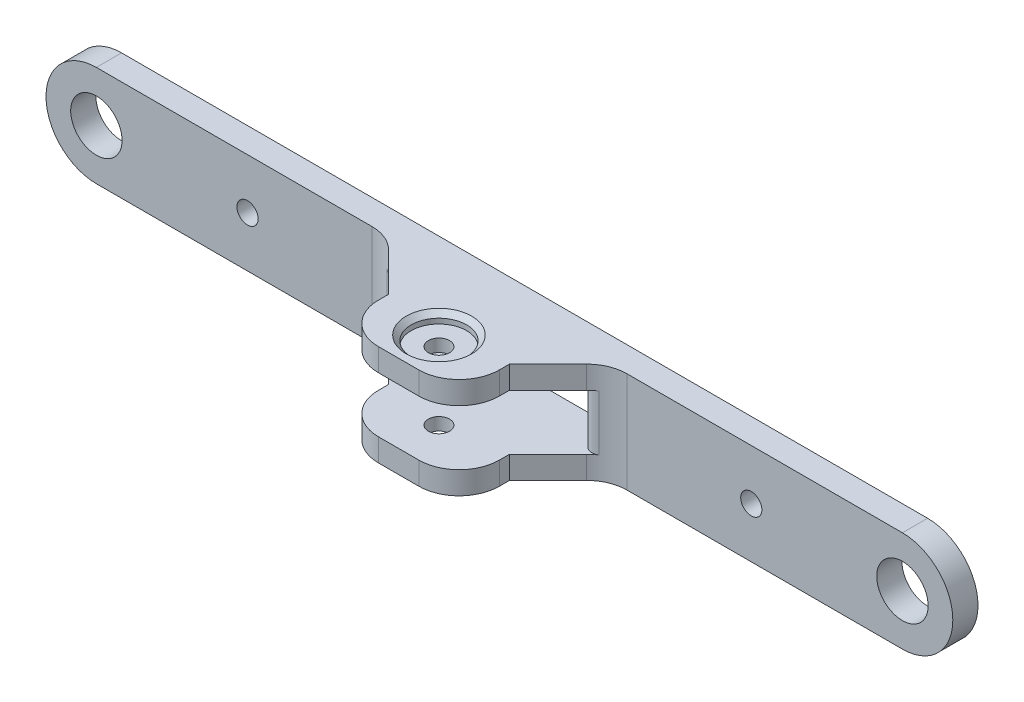
from build123d import *

# Parameters (mm, degrees)
BOSS_EXTRU_1_DEPTH      = 5
ESQUISSE2_R             = 5.1
ESQUISSE2_R_2           = 2.1
ENL_V_MAT_EXTRU_1_DEPTH = 91.691785736
ESQUISSE3_W             = 24
ESQUISSE3_H             = 20
BOSS_EXTRU_2_DEPTH      = 20
CHANFREIN1_SIZE         = 10
ESQUISSE4_W             = 36
ESQUISSE4_H             = 11
ENL_V_MAT_EXTRU_2_DEPTH = 20
ESQUISSE5_R             = 2.1
ENL_V_MAT_EXTRU_3_DEPTH = 96.524865873
CONG_1_R                = 8
ESQUISSE6_R             = 5.5
ENL_V_MAT_EXTRU_4_DEPTH = 2
CHANFREIN2_SIZE         = 1
CONG_4_R                = 2
ENL_V_START             = -2
ESQUISSE7_R             = 5.5
ENL_V_MAT_EXTRU_5_DEPTH = 2
CHANFREIN3_SIZE         = 1
ESQUISSE8_W             = 36
ESQUISSE8_H             = 11
ENL_V_MAT_EXTRU_6_DEPTH = 93.736184955
ESQUISSE9_W             = 2
ESQUISSE9_H             = 5
ENL_V_MAT_EXTRU_7_DEPTH = 2


with BuildPart() as part:
    # Esquisse1 → Boss.-Extru.1 (new body)
    with BuildSketch(Plane.XY):
        with BuildLine():
            Line((-80, 10), (80, 10))
            ThreePointArc((80, 10), (90, 0), (80, -10))
            Line((80, -10), (-80, -10))
            ThreePointArc((-80, -10), (-90, 0), (-80, 10))
        make_face()
    extrude(amount=BOSS_EXTRU_1_DEPTH)

    # Esquisse2 → Enlèv. mat.-Extru.1 (cut, through all)
    with BuildSketch(Plane.XY.offset(5)):
        with Locations((-80, 0)):
            Circle(ESQUISSE2_R)
        with Locations((80, 0)):
            Circle(ESQUISSE2_R)
        with Locations((-50, 0)):
            Circle(ESQUISSE2_R_2)
        with Locations((50, 0)):
            Circle(ESQUISSE2_R_2)
    extrude(amount=-ENL_V_MAT_EXTRU_1_DEPTH, mode=Mode.SUBTRACT)

    # Esquisse3 → Boss.-Extru.2 (add)
    with BuildSketch(Plane.XY.offset(5)):
        Rectangle(ESQUISSE3_W, ESQUISSE3_H)
    extrude(amount=BOSS_EXTRU_2_DEPTH)

    # Chanfrein1
    chanfrein1_edges = [part.edges().sort_by_distance(p)[0] for p in [
        (12, 0, 5),
        (-12, 0, 5),
    ]]
    chamfer(chanfrein1_edges, length=CHANFREIN1_SIZE)

    # Esquisse4 → Enlèv. mat.-Extru.2 (cut)
    with BuildSketch(Plane.XY.offset(25)):
        Rectangle(ESQUISSE4_W, ESQUISSE4_H)
    extrude(amount=-ENL_V_MAT_EXTRU_2_DEPTH, mode=Mode.SUBTRACT)

    # Esquisse5 → Enlèv. mat.-Extru.3 (cut, through all)
    with BuildSketch(Plane(origin=(0, 10, 0), x_dir=(1, 0, 0), z_dir=(0, 1, 0))):
        with Locations(Location((0, -17, 0), (0, 0, 270))):
            Circle(ESQUISSE5_R)
    extrude(amount=-ENL_V_MAT_EXTRU_3_DEPTH, mode=Mode.SUBTRACT)

    # Congé1
    cong_1_edges = [part.edges().sort_by_distance(p)[0] for p in [
        (-22, 0, 5),
        (-12, -7.75, 25),
        (12, -7.75, 25),
        (22, 0, 5),
        (-12, 7.75, 25),
        (12, 7.75, 25),
    ]]
    fillet(cong_1_edges, radius=CONG_1_R)

    # Esquisse6 → Enlèv. mat.-Extru.4 (cut)
    with BuildSketch(Plane(origin=(0, 10, 0), x_dir=(1, 0, 0), z_dir=(0, 1, 0))):
        with Locations(Location((0, -17, 0), (0, 0, 270))):
            Circle(ESQUISSE6_R)
    extrude(amount=-ENL_V_MAT_EXTRU_4_DEPTH, mode=Mode.SUBTRACT)

    # Chanfrein2
    chanfrein2_edges = [part.edges().sort_by_distance(p)[0] for p in [
        (0, 10, 11.5),
    ]]
    chamfer(chanfrein2_edges, length=CHANFREIN2_SIZE)

    # Congé4
    # the kernel refuses this fillet: 2 mm, written as the material it takes off along each edge
    with BuildSketch(Plane(origin=(18, -5.5, 9), x_dir=(0.7394878589424565, 0, -0.6731698942144558), z_dir=(0, 1, 0)), Plane(origin=(-18, 5.5, 9), x_dir=(-0.7394878589424565, 0, -0.6731698942144557), z_dir=(0, -1, 0))) as cong_4_piece_1:
        with BuildLine():
            CenterArc((4.431818389, 1.970329953), CONG_4_R, 150.40864019, 109.709922664)
            Line((2.692679577, 2.957951436), (2.518765696, 3.056713584))
            ThreePointArc((2.518765696, 3.056713584), (1.198442217, 1.613609697), (-0.147897572, 0.134633979))
            Line((-0.147897572, 0.134633979), (0.009378777, -0.199779975))
            ThreePointArc((0.009378777, -0.199779975), (2.349946778, -0.089900774), (4.054276537, -0.197032995))
            Line((4.054276537, -0.197032995), (4.088598523, 0))
        make_face()
    extrude(amount=11, mode=Mode.SUBTRACT)

    # Esquisse7 → Enlèv. mat.-Extru.5 (cut)
    with BuildSketch(Plane.XZ.offset(10).offset(ENL_V_START)):
        with Locations(Location((0, 17, 0), (0, 0, 90))):
            Circle(ESQUISSE7_R)
    extrude(amount=ENL_V_MAT_EXTRU_5_DEPTH, mode=Mode.SUBTRACT)

    # Chanfrein3
    chanfrein3_edges = [part.edges().sort_by_distance(p)[0] for p in [
        (0, -10, 11.5),
    ]]
    chamfer(chanfrein3_edges, length=CHANFREIN3_SIZE)

    # Esquisse8 → Enlèv. mat.-Extru.6 (cut, through all)
    with BuildSketch(Plane.XY.offset(5)):
        Rectangle(ESQUISSE8_W, ESQUISSE8_H)
    extrude(amount=-ENL_V_MAT_EXTRU_6_DEPTH, mode=Mode.SUBTRACT)

    # Esquisse9 → Enlèv. mat.-Extru.7 (cut)
    with BuildSketch(Plane.XZ.offset(10)):
        with Locations((0, 2.5)):
            Rectangle(ESQUISSE9_W, ESQUISSE9_H)
    extrude(amount=-ENL_V_MAT_EXTRU_7_DEPTH, mode=Mode.SUBTRACT)


solid = part.part
